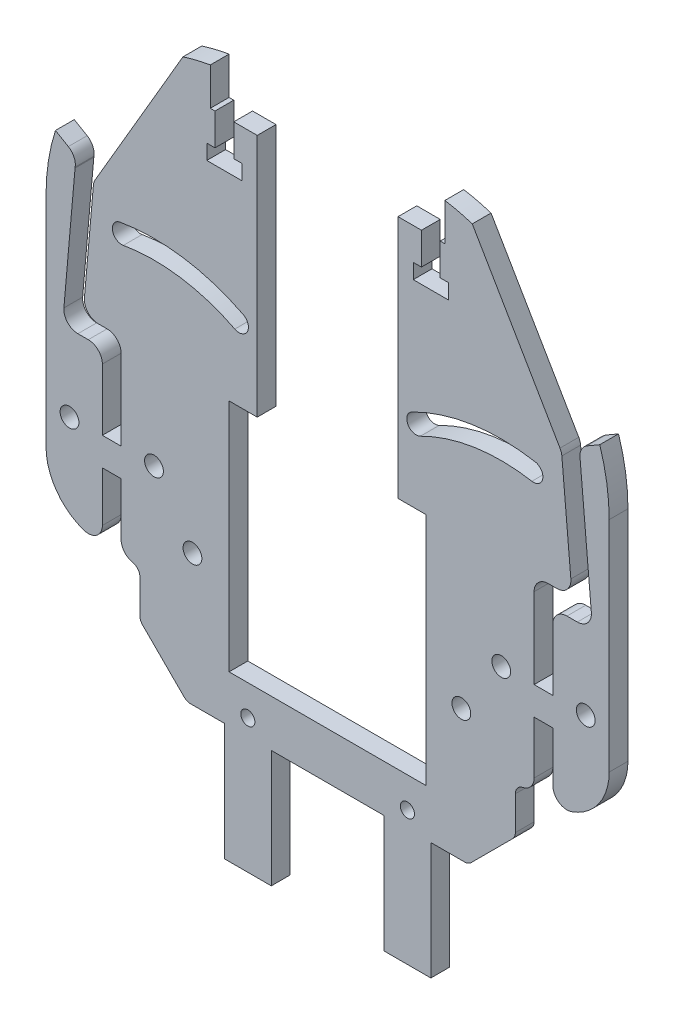
from build123d import *

# Parameters (mm, degrees)
BOSS_EXTRUDE1_DEPTH = 4
SKETCH2_R           = 2
SKETCH2_R_2         = 1.5
CUT_EXTRUDE1_DEPTH  = 95.026591983
SKETCH4_W           = 20
SKETCH4_H           = 100
BOSS_EXTRUDE2_DEPTH = 4
FILLET3_R           = 42
FILLET4_R           = 12
SKETCH7_R           = 2
CUT_EXTRUDE3_DEPTH  = 105.120122935
CHAMFER1_SIZE       = 10
FILLET8_R           = 2
CUT_EXTRUDE4_DEPTH  = 105.120122935
CUT_EXTRUDE5_DEPTH  = 105.120122935
SKETCH10_W          = 4
SKETCH10_H          = 14.148423286
CUT_EXTRUDE6_DEPTH  = 105.120122935
FILLET11_R          = 3
FILLET12_R          = 3


with BuildPart() as part:
    # Sketch1 → Boss-Extrude1 (new body)
    with BuildSketch(Plane.XY):
        Polygon((-40, 60), (-25, 60), (-25, 52), (-15, 52), (-15, 0), (-21, 0), (-21, -50), (21, -50), (21, 0), (15, 0), (15, 52), (25, 52), (25, 60), (40, 60), (40, -60), (22, -60), (22, -85), (12, -85), (12, -60), (-12, -60), (-12, -85), (-22, -85), (-22, -60), (-40, -60), align=None)
    extrude(amount=BOSS_EXTRUDE1_DEPTH)

    # Sketch2 → Cut-Extrude1 (cut, through all)
    with BuildSketch(Plane(origin=(0, 0, 0), x_dir=(-1, 0, 0), z_dir=(0, 0, -1))):
        with Locations((-28.5, -32)):
            Circle(SKETCH2_R)
        with Locations((17, -56.5)):
            Circle(SKETCH2_R_2)
        with Locations((28.8, -32)):
            Circle(SKETCH2_R)
        with Locations((-17, -56.5)):
            Circle(SKETCH2_R_2)
    extrude(amount=-CUT_EXTRUDE1_DEPTH, mode=Mode.SUBTRACT)

    # Sketch4 → Boss-Extrude2 (add)
    with BuildSketch(Plane.XY.offset(4)):
        with Locations((-50, 10)):
            Rectangle(SKETCH4_W, SKETCH4_H)
        with Locations((50, 10)):
            Rectangle(SKETCH4_W, SKETCH4_H)
    extrude(amount=-BOSS_EXTRUDE2_DEPTH)

    # Fillet3
    # the kernel refuses this fillet: 42 mm, written as the material it takes off along each edge
    with BuildSketch(Plane(origin=(60, 60, 107.531396204), x_dir=(0, -1, 0), z_dir=(0, 0, -1))) as fillet3_piece_1:
        with BuildLine():
            CenterArc((41.412558482, 42), FILLET3_R, 189.594068227, 80.405931773)
            Line((0, 35), (-0.82825117, 34.86))
            ThreePointArc((-0.82825117, 34.86), (-0.84, 17.5), (-0.84, 0))
            Line((-0.84, 0), (0, -0.84))
            Line((0, -0.84), (41.412558482, -0.84))
            Line((41.412558482, -0.84), (41.412558482, 0))
        make_face()
    extrude(amount=211.062792409, mode=Mode.SUBTRACT)
    with BuildSketch(Plane(origin=(-60, 60, 107.531396204), x_dir=(1, 0, 0), z_dir=(0, 0, -1))) as fillet3_piece_2:
        with BuildLine():
            CenterArc((42, 41.412558482), FILLET3_R, 180, 80.405931773)
            Line((0, 41.412558482), (-0.84, 41.412558482))
            Line((-0.84, 41.412558482), (-0.84, 0))
            Line((-0.84, 0), (0, -0.84))
            ThreePointArc((0, -0.84), (17.5, -0.84), (34.86, -0.82825117))
            Line((34.86, -0.82825117), (35, 0))
        make_face()
    extrude(amount=211.062792409, mode=Mode.SUBTRACT)

    # Fillet4
    fillet4_edges = [part.edges().sort_by_distance(p)[0] for p in [
        (60, -40, 2),
        (-60, -40, 2),
    ]]
    fillet(fillet4_edges, radius=FILLET4_R)

    # Sketch7 → Cut-Extrude3 (cut, through all)
    with BuildSketch(Plane.XY):
        with Locations(Location((-55, -20, 0), (0, 0, 180))):
            Circle(SKETCH7_R)
        with Locations(Location((55, -20, 0), (0, 0, 180))):
            Circle(SKETCH7_R)
        with Locations(Location((-37, -20, 0), (0, 0, 180))):
            Circle(SKETCH7_R)
        with Locations(Location((37, -20, 0), (0, 0, 180))):
            Circle(SKETCH7_R)
    extrude(amount=CUT_EXTRUDE3_DEPTH, mode=Mode.SUBTRACT)

    # Chamfer1
    chamfer1_edges = [part.edges().sort_by_distance(p)[0] for p in [
        (-40, -60, 2),
        (40, -60, 2),
    ]]
    chamfer(chamfer1_edges, length=CHAMFER1_SIZE)

    # Fillet8
    fillet8_edges = [part.edges().sort_by_distance(p)[0] for p in [
        (-30, -60, 2),
        (-40, -50, 2),
        (30, -60, 2),
        (40, -50, 2),
        (40, -40, 2),
        (-40, -40, 2),
    ]]
    fillet(fillet8_edges, radius=FILLET8_R)

    # Sketch8 → Cut-Extrude4 (cut, through all)
    with BuildSketch(Plane(origin=(0, 0, 0), x_dir=(-1, 0, 0), z_dir=(0, 0, -1))):
        with BuildLine():
            ThreePointArc((-17.964817996, 17.438774634), (-30.770630407, 21.535466224), (-44.214817996, 21.375674028))
            ThreePointArc((-44.214817996, 21.375674028), (-45.841525426, 19.061841075), (-43.527692473, 17.435133644))
            ThreePointArc((-43.527692473, 17.435133644), (-31.363903701, 17.579707536), (-19.777692473, 13.87317705))
            ThreePointArc((-19.777692473, 13.87317705), (-17.088456442, 14.749538603), (-17.964817996, 17.438774634))
        make_face()
        with BuildLine():
            ThreePointArc((17.964817996, 17.438774634), (30.770630407, 21.535466224), (44.214817996, 21.375674028))
            ThreePointArc((44.214817996, 21.375674028), (45.841525426, 19.061841075), (43.527692473, 17.435133644))
            ThreePointArc((43.527692473, 17.435133644), (31.363903701, 17.579707536), (19.777692473, 13.87317705))
            ThreePointArc((19.777692473, 13.87317705), (17.088456442, 14.749538603), (17.964817996, 17.438774634))
        make_face()
    extrude(amount=-CUT_EXTRUDE4_DEPTH, mode=Mode.SUBTRACT)

    # Sketch9 → Cut-Extrude5 (cut, through all)
    with BuildSketch(Plane.XY.offset(4)):
        Polygon((-24, 52), (-20, 52), (-20, 45.2), (-18.25, 45.2), (-18.25, 42), (-25.75, 42), (-25.75, 45.2), (-24, 45.2), align=None)
    cut_extrude5 = extrude(amount=-CUT_EXTRUDE5_DEPTH, mode=Mode.SUBTRACT)

    # Mirror1: Cut-Extrude5 across plane
    add(cut_extrude5.mirror(Plane(origin=(0, 0, 0), x_dir=(0, 0, 1), z_dir=(1, 0, 0))), mode=Mode.SUBTRACT)

    # Sketch10 → Cut-Extrude6 (cut, through all)
    with BuildSketch(Plane.XY.offset(4)):
        with Locations((46, -32.925788357)):
            Rectangle(SKETCH10_W, SKETCH10_H)
        with BuildLine():
            Line((44, -19.851576714), (48, -19.851576714))
            Line((48, -19.851576714), (48, -3.703153428))
            Line((48, -3.703153428), (56.485281374, -3.703153428))
            Line((56.485281374, -3.703153428), (53.762388988, 27.211478811))
            Line((53.762388988, 27.211478811), (53.006446404, 28.506843132))
            Line((53.006446404, 28.506843132), (57.992638284, 31.416661411))
            ThreePointArc((57.992638284, 31.416661411), (47.696624216, 48.287786805), (30.824208916, 58.581686925))
            Line((30.824208916, 58.581686925), (49.856368895, 25.968653244))
            Line((49.856368895, 25.968653244), (52.117484809, 0.296846572))
            Line((52.117484809, 0.296846572), (44, 0.296846572))
            Line((44, 0.296846572), (44, -19.851576714))
        make_face()
    cut_extrude6 = extrude(amount=-CUT_EXTRUDE6_DEPTH, mode=Mode.SUBTRACT)

    # Mirror5: Cut-Extrude6 across plane
    add(cut_extrude6.mirror(Plane(origin=(0, 0, 0), x_dir=(0, 0, 1), z_dir=(1, 0, 0))), mode=Mode.SUBTRACT)

    # Fillet11
    fillet11_edges = [part.edges().sort_by_distance(p)[0] for p in [
        (-53.762388988, 27.211478811, 2),
        (-49.856368895, 25.968653244, 2),
        (-52.117484809, 0.296846572, 2),
        (-56.485281374, -3.703153428, 2),
        (-48, -3.703153428, 2),
        (-44, 0.296846572, 2),
        (-48, -40, 2),
        (-44, -40, 2),
        (53.762388988, 27.211478811, 2),
        (49.856368895, 25.968653244, 2),
        (52.117484809, 0.296846572, 2),
        (56.485281374, -3.703153428, 2),
        (48, -3.703153428, 2),
        (44, 0.296846572, 2),
        (44, -40, 2),
        (48, -40, 2),
    ]]
    fillet(fillet11_edges, radius=FILLET11_R)

    # Fillet12
    fillet12_edges = [part.edges().sort_by_distance(p)[0] for p in [
        (-53.006446404, 28.506843132, 2),
        (53.006446404, 28.506843132, 2),
    ]]
    fillet(fillet12_edges, radius=FILLET12_R)


solid = part.part
